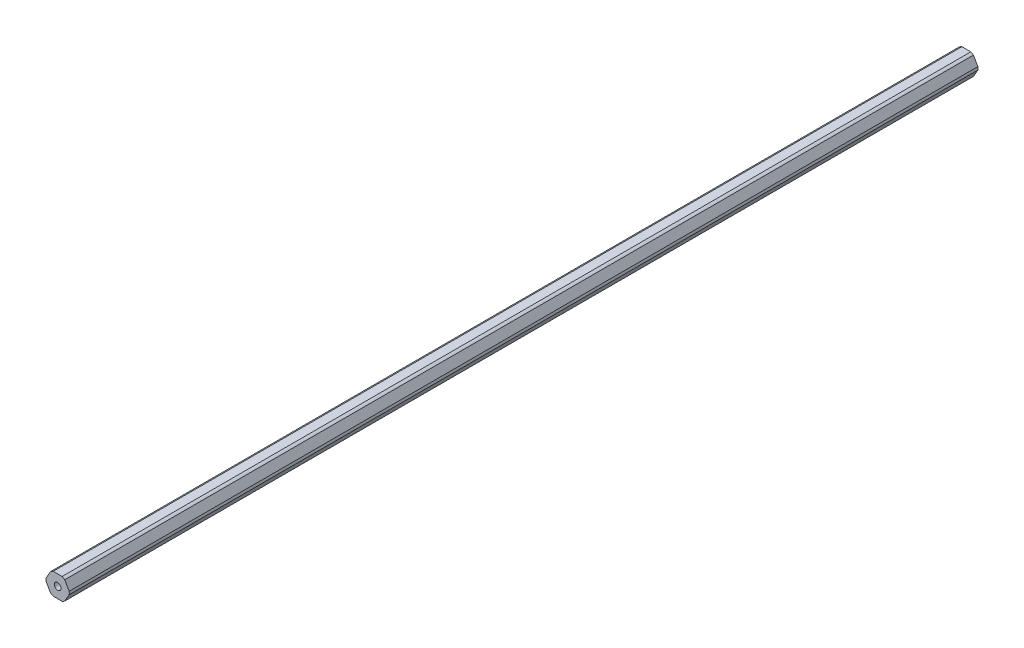
from build123d import *

# Parameters (mm, degrees)
SKETCH1_R           = 2.000000064
BOSS_EXTRUDE1_DEPTH = 536.575


with BuildPart() as part:
    # Sketch1 → Boss-Extrude1 (new body)
    with BuildSketch(Plane.XY):
        with BuildLine():
            ThreePointArc((6.874999966, 0), (6.860422465, 0.447468582), (6.816751782, 0.893039571))
            Line((6.816751782, 0.893039571), (4.181770846, 5.456960429))
            ThreePointArc((4.181770846, 5.456960429), (3.437499983, 5.953924622), (2.634980936, 6.35))
            Line((2.634980936, 6.35), (-2.634980936, 6.35))
            ThreePointArc((-2.634980936, 6.35), (-3.437499983, 5.953924622), (-4.181770846, 5.456960429))
            Line((-4.181770846, 5.456960429), (-6.816751782, 0.893039571))
            ThreePointArc((-6.816751782, 0.893039571), (-6.874999966, 0), (-6.816751782, -0.893039571))
            Line((-6.816751782, -0.893039571), (-4.181770846, -5.456960429))
            ThreePointArc((-4.181770846, -5.456960429), (-3.437499983, -5.953924622), (-2.634980936, -6.35))
            Line((-2.634980936, -6.35), (2.634980936, -6.35))
            ThreePointArc((2.634980936, -6.35), (3.437499983, -5.953924622), (4.181770846, -5.456960429))
            Line((4.181770846, -5.456960429), (6.816751782, -0.893039571))
            ThreePointArc((6.816751782, -0.893039571), (6.860422465, -0.447468582), (6.874999966, 0))
        make_face()
        Circle(SKETCH1_R, mode=Mode.SUBTRACT)
    extrude(amount=BOSS_EXTRUDE1_DEPTH)


solid = part.part
